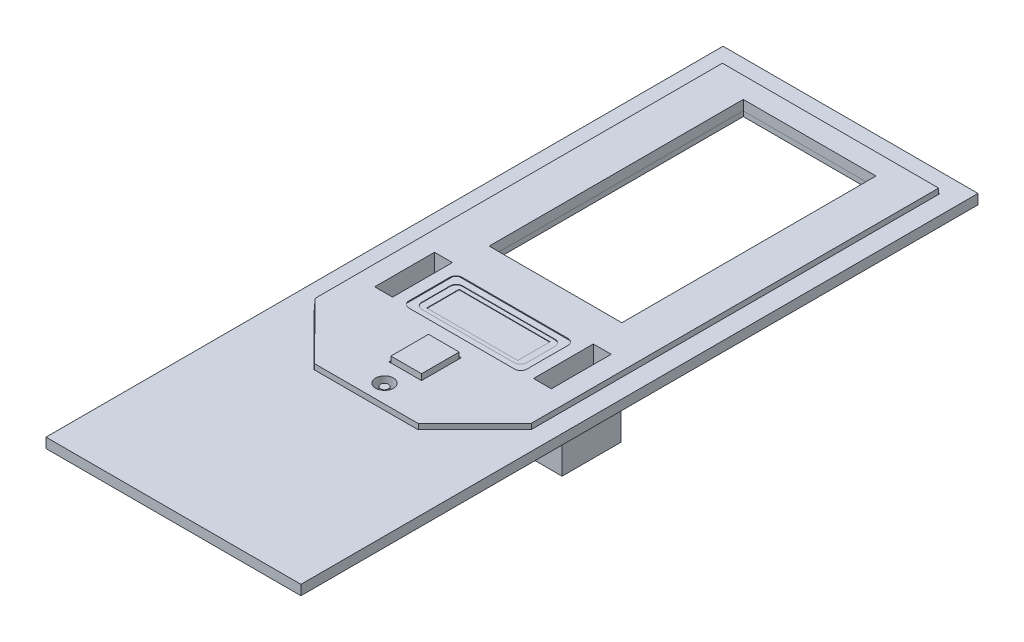
from build123d import *

# Parameters (mm, degrees)
SKETCH1_W                   = 51.332398317
SKETCH1_H                   = 136.325385694
BOSS_EXTRUDE1_DEPTH         = 2
CUT_EXTRUDE1_DEPTH          = 1
SKETCH3_W                   = 26.718092566
SKETCH3_H                   = 51.160838605
CUT_EXTRUDE2_DEPTH          = 1
SKETCH4_W                   = 20.659186536
SKETCH4_H                   = 13.604488078
BOSS_EXTRUDE2_DEPTH         = 1
SKETCH5_W                   = 6.521739131
SKETCH5_H                   = 14.853538096
SKETCH5_W_2                 = 6.52173913
SKETCH5_H_2                 = 15.644764374
CUT_EXTRUDE3_DEPTH          = 1
SKETCH6_W                   = 6.171107994
SKETCH6_H                   = 7.573632539
CUT_EXTRUDE4_DEPTH          = 1
SKETCH7_R                   = 2.489481066
CUT_EXTRUDE5_DEPTH          = 1
BOSS_EXTRUDE3_DEPTH         = 1
SKETCH10_W                  = 6.171107994
SKETCH10_H                  = 7.573632539
BOSS_EXTRUDE4_DEPTH         = 4
BOSS_EXTRUDE5_DEPTH         = 2
SKETCH12_W                  = 6.571107994
SKETCH12_H                  = 7.973632539
CUT_EXTRUDE6_DEPTH          = 2
SKETCH13_R                  = 1.8
SKETCH13_W                  = 26.718092566
SKETCH13_H                  = 51.160838605
CUT_EXTRUDE9_DEPTH          = 2
SKETCH14_R                  = 2.2
SKETCH14_R_2                = 1.8
BOSS_EXTRUDE11_DEPTH        = 2
SKETCH17_R                  = 2.2
BOSS_EXTRUDE12_DEPTH        = 1
SKETCH18_R                  = 0.8
BOSS_EXTRUDE15_DEPTH        = 3.4
EXTRUDE_THIN3_OUTLINE_W     = 5.6
EXTRUDE_THIN3_OUTLINE_H     = 14.844764374
EXTRUDE_THIN3_OUTLINE_W_2   = 3.6
EXTRUDE_THIN3_OUTLINE_H_2   = 12.844764374
EXTRUDE_THIN3_DEPTH         = 13.32398317
EXTRUDE_THIN3_2_OUTLINE_W   = 5.6
EXTRUDE_THIN3_2_OUTLINE_H   = 14.053538096
EXTRUDE_THIN3_2_OUTLINE_W_2 = 3.6
EXTRUDE_THIN3_2_OUTLINE_H_2 = 12.053538096
EXTRUDE_THIN3_2_DEPTH       = 13.32398317
SKETCH26_W                  = 3.6
SKETCH26_H                  = 12.053538096
SKETCH26_H_2                = 12.844764374
CUT_EXTRUDE12_DEPTH         = 13.32398317
SKETCH27_W                  = 5.6
SKETCH27_H                  = 14.053538096
BOSS_EXTRUDE18_DEPTH        = 1
SKETCH27_W_2                = 5.570395019
SKETCH27_H_2                = 14.844764374
BOSS_EXTRUDE18_2_DEPTH      = 1
SKETCH28_W                  = 20.659186536
SKETCH28_H                  = 13.604488078
CUT_EXTRUDE13_DEPTH         = 1
SKETCH29_W                  = 23.777559608
SKETCH29_H                  = 10.728152402
CUT_EXTRUDE15_DEPTH         = 10
SKETCH30_W                  = 23.777559608
SKETCH30_H                  = 10.728152402
SKETCH30_W_2                = 21.112762974
SKETCH30_H_2                = 8.203608222
BOSS_EXTRUDE20_DEPTH        = 1.8
SKETCH31_W                  = 21.112762974
SKETCH31_H                  = 8.203608222
BOSS_EXTRUDE21_DEPTH        = 1.6
SKETCH35_W                  = 23.977559608
SKETCH35_H                  = 10.928152402
CUT_EXTRUDE21_DEPTH         = 1.9
FILLET2_R                   = 1.25
FILLET3_R                   = 1.25
SKETCH37_W                  = 18.307713885
SKETCH37_H                  = 6.527591392
CUT_EXTRUDE22_DEPTH         = 0.1
SKETCH41_W                  = 18.307713885
SKETCH41_H                  = 6.527591392
BOSS_EXTRUDE27_DEPTH        = 0.1
SKETCH43_W                  = 18.307713885
SKETCH43_H                  = 6.527591392
BOSS_EXTRUDE28_DEPTH        = 0.1
CUT_EXTRUDE24_DEPTH         = 40.1
SKETCH51_W                  = 5.6
SKETCH51_H                  = 4.468914857
BOSS_EXTRUDE29_DEPTH        = 1
BOSS_EXTRUDE29_2_DEPTH      = 1
SKETCH52_W                  = 5.6
SKETCH52_H                  = 1
BOSS_EXTRUDE30_DEPTH        = 2.5
BOSS_EXTRUDE30_2_DEPTH      = 2.5
SKETCH53_W                  = 5.6
SKETCH53_H                  = 1
BOSS_EXTRUDE31_DEPTH        = 1
BOSS_EXTRUDE32_REACH        = 81.818
SKETCH54_W                  = 5.6
SKETCH54_H                  = 1
SKETCH55_W                  = 3.6
SKETCH55_H                  = 0.791226278
BOSS_EXTRUDE33_DEPTH        = 14.323983
SKETCH56_W                  = 0.791226278
SKETCH56_H                  = 13.32398317
CUT_EXTRUDE25_DEPTH         = 5.6
CUT_EXTRUDE_THIN1_DEPTH     = 1


with BuildPart() as part:
    # Sketch1 → Boss-Extrude1 (new body)
    with BuildSketch(Plane(origin=(0, 0, 0), x_dir=(1, 0, 0), z_dir=(0, 1, 0))):
        with Locations((-5.767223106, -3.58751015)):
            Rectangle(SKETCH1_W, SKETCH1_H)
    extrude(amount=BOSS_EXTRUDE1_DEPTH)

    # Sketch2 → Cut-Extrude1 (cut)
    with BuildSketch(Plane(origin=(0, 2, 0), x_dir=(1, 0, 0), z_dir=(0, 1, 0))):
        Polygon((-27.541416655, -30.445855171), (-27.541416655, 60.542924633), (16.006970442, 60.542924633), (16.006970442, -30.445855171), (4.678976052, -41.666051524), (-16.213422265, -41.666051524), align=None)
    extrude(amount=-CUT_EXTRUDE1_DEPTH, mode=Mode.SUBTRACT)

    # Sketch3 → Cut-Extrude2 (cut)
    with BuildSketch(Plane(origin=(0, 1, 0), x_dir=(1, 0, 0), z_dir=(0, 1, 0))):
        with Locations((-5.767223107, 30.754931698)):
            Rectangle(SKETCH3_W, SKETCH3_H)
    extrude(amount=-CUT_EXTRUDE2_DEPTH, mode=Mode.SUBTRACT)

    # Sketch4 → Boss-Extrude2 (add)
    with BuildSketch(Plane(origin=(0, 1, 0), x_dir=(1, 0, 0), z_dir=(0, 1, 0))):
        with Locations((-5.767223107, -7.988180452)):
            Rectangle(SKETCH4_W, SKETCH4_H)
    extrude(amount=BOSS_EXTRUDE2_DEPTH)

    # Sketch5 → Cut-Extrude3 (cut)
    with BuildSketch(Plane(origin=(0, 1, 0), x_dir=(1, 0, 0), z_dir=(0, 1, 0))):
        with Locations((-21.756002911, -7.426769048)):
            Rectangle(SKETCH5_W, SKETCH5_H)
        with Locations((10.221556697, -7.031155909)):
            Rectangle(SKETCH5_W_2, SKETCH5_H_2)
    extrude(amount=-CUT_EXTRUDE3_DEPTH, mode=Mode.SUBTRACT)

    # Sketch6 → Cut-Extrude4 (cut)
    with BuildSketch(Plane(origin=(0, 1, 0), x_dir=(1, 0, 0), z_dir=(0, 1, 0))):
        with Locations((-5.767223107, -21.101784941)):
            Rectangle(SKETCH6_W, SKETCH6_H)
    extrude(amount=-CUT_EXTRUDE4_DEPTH, mode=Mode.SUBTRACT)

    # Sketch7 → Cut-Extrude5 (cut)
    with BuildSketch(Plane(origin=(0, 1, 0), x_dir=(1, 0, 0), z_dir=(0, 1, 0))):
        with Locations(Location((-5.767223107, -29.250452542, 0), (0, 0, 270))):
            Circle(SKETCH7_R)
    extrude(amount=-CUT_EXTRUDE5_DEPTH, mode=Mode.SUBTRACT)

    # Sketch8 → Boss-Extrude3 (add)
    with BuildSketch(Plane(origin=(0, 1, 0), x_dir=(1, 0, 0), z_dir=(0, 1, 0))):
        Polygon((-27.541416655, -21.480466567), (-27.541416655, -30.445855171), (-16.213422265, -41.666051524), (4.678976052, -41.666051524), (16.006970442, -30.445855171), (16.006970442, -21.480466567), (4.673870862, -32.903327717), (-16.208317076, -32.903327717), align=None)
    extrude(amount=BOSS_EXTRUDE3_DEPTH)

    # Sketch10 → Boss-Extrude4 (add)
    with BuildSketch(Plane.XZ):
        with Locations((-5.767223107, 21.101784941)):
            Rectangle(SKETCH10_W, SKETCH10_H)
    extrude(amount=-BOSS_EXTRUDE4_DEPTH)

    # Sketch28 → Cut-Extrude13 (cut)
    with BuildSketch(Plane(origin=(0, 2, 0), x_dir=(1, 0, 0), z_dir=(0, 1, 0))):
        with Locations((-5.767223107, -7.988180452)):
            Rectangle(SKETCH28_W, SKETCH28_H)
    extrude(amount=-CUT_EXTRUDE13_DEPTH, mode=Mode.SUBTRACT)


with BuildPart() as body_2:
    # Sketch11 → Boss-Extrude5 (new body)
    with BuildSketch(Plane(origin=(0, 1, 0), x_dir=(1, 0, 0), z_dir=(0, 1, 0))):
        Polygon((-27.541416655, 60.542924633), (16.006970442, 60.542924633), (16.006970442, -21.480466567), (4.673870862, -32.903327717), (-16.208317076, -32.903327717), (-27.541416655, -21.480466567), align=None)
    extrude(amount=BOSS_EXTRUDE5_DEPTH)

    # Sketch12 → Cut-Extrude6 (cut)
    with BuildSketch(Plane(origin=(0, 3, 0), x_dir=(1, 0, 0), z_dir=(0, 1, 0))):
        with Locations((-5.767223107, -21.10178494)):
            Rectangle(SKETCH12_W, SKETCH12_H)
    extrude(amount=-CUT_EXTRUDE6_DEPTH, mode=Mode.SUBTRACT)

    # Sketch13 → Cut-Extrude9 (cut)
    with BuildSketch(Plane.XZ.offset(-1)):
        with Locations(Location((-5.767223107, 29.250452542, 0), (0, 0, 270))):
            Circle(SKETCH13_R)
        with Locations((-5.767223107, -30.754931698)):
            Rectangle(SKETCH13_W, SKETCH13_H)
    extrude(amount=-CUT_EXTRUDE9_DEPTH, mode=Mode.SUBTRACT)


with BuildPart() as body_3:
    # Sketch14 → Boss-Extrude11 (new body)
    with BuildSketch(Plane.XZ.offset(-1)):
        with Locations(Location((-5.767223107, 29.250452542, 0), (0, 0, 270))):
            Circle(SKETCH14_R)
        with Locations(Location((-5.767223107, 29.250452542, 0), (0, 0, 270))):
            Circle(SKETCH14_R_2, mode=Mode.SUBTRACT)
    extrude(amount=BOSS_EXTRUDE11_DEPTH)

    # Combine1: union body 2
    add(body_2.part)

    # Sketch17 → Boss-Extrude12 (add)
    with BuildSketch(Plane.XZ.offset(1)):
        with Locations(Location((-5.767223107, 29.250452542, 0), (0, 0, 270))):
            Circle(SKETCH17_R)
    extrude(amount=BOSS_EXTRUDE12_DEPTH)


with BuildPart() as body_3_2:
    # Sketch18 → Boss-Extrude15 (new body)
    with BuildSketch(Plane(origin=(0, -1, 0), x_dir=(1, 0, 0), z_dir=(0, 1, 0))):
        with Locations(Location((-5.767223107, -29.250452542, 0), (0, 0, 270))):
            Circle(SKETCH18_R)
    extrude(amount=BOSS_EXTRUDE15_DEPTH)


with BuildPart() as body_3_1:
    add(body_3.part)

    # Combine3: union body 3 2
    add(body_3_2.part)

    # Sketch26 → Cut-Extrude12 (cut)
    with BuildSketch(Plane.XZ.offset(-1)):
        with Locations((-21.756002911, 7.426769048)):
            Rectangle(SKETCH26_W, SKETCH26_H)
        with Locations((10.221556697, 7.031155909)):
            Rectangle(SKETCH26_W, SKETCH26_H_2)
    extrude(amount=-CUT_EXTRUDE12_DEPTH, mode=Mode.SUBTRACT)


with BuildPart() as body_3_3:
    # Extrude-Thin3: read off the stored shape, not the designer's step
    # Extrude-Thin3 outline → Extrude-Thin3 (new body)
    with BuildSketch(Plane.XZ.offset(-1)):
        with Locations((10.221556697, 7.031155909)):
            Rectangle(EXTRUDE_THIN3_OUTLINE_W, EXTRUDE_THIN3_OUTLINE_H)
        with Locations((10.221556697, 7.031155909)):
            Rectangle(EXTRUDE_THIN3_OUTLINE_W_2, EXTRUDE_THIN3_OUTLINE_H_2, mode=Mode.SUBTRACT)
    extrude(amount=EXTRUDE_THIN3_DEPTH)


with BuildPart() as body_4:
    # Extrude-Thin3 2 outline → Extrude-Thin3 2 (new body)
    with BuildSketch(Plane.XZ.offset(-1)):
        with Locations((-21.756002911, 7.426769048)):
            Rectangle(EXTRUDE_THIN3_2_OUTLINE_W, EXTRUDE_THIN3_2_OUTLINE_H)
        with Locations((-21.756002911, 7.426769048)):
            Rectangle(EXTRUDE_THIN3_2_OUTLINE_W_2, EXTRUDE_THIN3_2_OUTLINE_H_2, mode=Mode.SUBTRACT)
    extrude(amount=EXTRUDE_THIN3_2_DEPTH)


with BuildPart() as body_5:
    # Sketch27 → Boss-Extrude18 (new body)
    with BuildSketch(Plane.XZ.offset(12.32398317)):
        with Locations((-21.756002911, 7.426769048)):
            Rectangle(SKETCH27_W, SKETCH27_H)
    extrude(amount=-BOSS_EXTRUDE18_DEPTH)


with BuildPart() as body_6:
    # Sketch27 → Boss-Extrude18 2 (new body)
    with BuildSketch(Plane.XZ.offset(12.32398317)):
        with Locations((10.206754207, 7.031155909)):
            Rectangle(SKETCH27_W_2, SKETCH27_H_2)
    extrude(amount=-BOSS_EXTRUDE18_2_DEPTH)


with BuildPart() as body_4_1:
    add(body_4.part)

    # Combine4: union body 3 3, body 3, body 5, body 6
    add(body_3_3.part)
    add(body_3_1.part)
    add(body_5.part)
    add(body_6.part)

    # Sketch29 → Cut-Extrude15 (cut)
    with BuildSketch(Plane(origin=(0, 3, 0), x_dir=(1, 0, 0), z_dir=(0, 1, 0))):
        with Locations((-5.767223107, -8.341916313)):
            Rectangle(SKETCH29_W, SKETCH29_H)
    extrude(amount=-CUT_EXTRUDE15_DEPTH, mode=Mode.SUBTRACT)

    # Sketch35 → Cut-Extrude21 (cut)
    with BuildSketch(Plane.XZ.offset(-1)):
        with Locations((-5.767223107, 8.341916313)):
            Rectangle(SKETCH35_W, SKETCH35_H)
    extrude(amount=-CUT_EXTRUDE21_DEPTH, mode=Mode.SUBTRACT)

    # Fillet2
    fillet2_edges = [body_4_1.edges().sort_by_distance(p)[0] for p in [
        (-17.656002911, 2.95, 13.705992514),
        (6.121556697, 2.95, 13.705992514),
        (6.121556697, 2.95, 2.977840112),
        (-17.656002911, 2.95, 2.977840112),
    ]]
    fillet(fillet2_edges, radius=FILLET2_R)

    # Sketch50 → Cut-Extrude24 (cut)
    with BuildSketch(Plane(origin=(13.021556697, 0, 0), x_dir=(0, 0, -1), z_dir=(1, 0, 0))):
        Polygon((-14.453538096, 1), (-11.293538096, -2.16), (-11.293538096, -12.32398317), (-14.453538096, -12.32398317), align=None)
    extrude(amount=-CUT_EXTRUDE24_DEPTH, mode=Mode.SUBTRACT)


with BuildPart() as body_3_4:
    # Sketch30 → Boss-Extrude20 (new body)
    with BuildSketch(Plane(origin=(0, 1, 0), x_dir=(1, 0, 0), z_dir=(0, 1, 0))):
        with Locations((-5.767223107, -8.341916313)):
            Rectangle(SKETCH30_W, SKETCH30_H)
        with Locations((-5.767223107, -8.341916313)):
            Rectangle(SKETCH30_W_2, SKETCH30_H_2, mode=Mode.SUBTRACT)
    extrude(amount=BOSS_EXTRUDE20_DEPTH)


with BuildPart() as body_4_2:
    # Sketch31 → Boss-Extrude21 (new body)
    with BuildSketch(Plane(origin=(0, 1, 0), x_dir=(1, 0, 0), z_dir=(0, 1, 0))):
        with Locations((-5.767223107, -8.341916313)):
            Rectangle(SKETCH31_W, SKETCH31_H)
    extrude(amount=BOSS_EXTRUDE21_DEPTH)


with BuildPart() as part_1:
    add(part.part)

    # Combine5: union body 3 4, body 4 2
    add(body_3_4.part)
    add(body_4_2.part)

    # Fillet3
    fillet3_edges = [part_1.edges().sort_by_distance(p)[0] for p in [
        (-16.323604594, 2.7, 12.443720424),
        (4.78915838, 2.7, 12.443720424),
        (4.78915838, 2.7, 4.240112202),
        (-16.323604594, 2.7, 4.240112202),
    ]]
    fillet(fillet3_edges, radius=FILLET3_R)

    # Sketch37 → Cut-Extrude22 (cut)
    with BuildSketch(Plane(origin=(0, 2.6, 0), x_dir=(1, 0, 0), z_dir=(0, 1, 0))):
        with Locations((-5.767223107, -8.341916313)):
            Rectangle(SKETCH37_W, SKETCH37_H)
    extrude(amount=-CUT_EXTRUDE22_DEPTH, mode=Mode.SUBTRACT)


with BuildPart() as body_3_5:
    # Sketch41 → Boss-Extrude27 (new body)
    with BuildSketch(Plane(origin=(0, 2.6, 0), x_dir=(1, 0, 0), z_dir=(0, 1, 0))):
        with BuildLine():
            Line((-15.073604594, -12.443720424), (3.53915838, -12.443720424))
            ThreePointArc((3.53915838, -12.443720424), (4.423041856, -12.077603901), (4.78915838, -11.193720424))
            Line((4.78915838, -11.193720424), (4.78915838, -5.490112202))
            ThreePointArc((4.78915838, -5.490112202), (4.423041856, -4.606228725), (3.53915838, -4.240112202))
            Line((3.53915838, -4.240112202), (-15.073604594, -4.240112202))
            ThreePointArc((-15.073604594, -4.240112202), (-15.95748807, -4.606228725), (-16.323604594, -5.490112202))
            Line((-16.323604594, -5.490112202), (-16.323604594, -11.193720424))
            ThreePointArc((-16.323604594, -11.193720424), (-15.95748807, -12.077603901), (-15.073604594, -12.443720424))
        make_face()
        with Locations((-5.767223107, -8.341916313)):
            Rectangle(SKETCH41_W, SKETCH41_H, mode=Mode.SUBTRACT)
    extrude(amount=BOSS_EXTRUDE27_DEPTH)

    # Combine6: union part
    add(part_1.part)


with BuildPart() as body_3_6:
    # Sketch43 → Boss-Extrude28 (new body)
    with BuildSketch(Plane(origin=(0, 2.5, 0), x_dir=(1, 0, 0), z_dir=(0, 1, 0))):
        with Locations((-5.767223107, -8.341916313)):
            Rectangle(SKETCH43_W, SKETCH43_H)
    extrude(amount=BOSS_EXTRUDE28_DEPTH)

    # Combine7: union body 3 5
    add(body_3_5.part)

    # Sketch58 → Cut-Extrude-Thin1 (cut)
    with BuildSketch(Plane(origin=(0, 1, 0), x_dir=(1, 0, 0), z_dir=(0, 1, 0))):
        Polygon((-16.249969686, -33.003327717), (4.715523472, -33.003327717), (16.106970442, -21.521657048), (16.106970442, 60.642924633), (-27.641416655, 60.642924633), (-27.641416655, -21.521657048), align=None)
        Polygon((-16.208317076, -32.903327717), (4.673870862, -32.903327717), (16.006970442, -21.480466567), (16.006970442, 60.542924633), (-27.541416655, 60.542924633), (-27.541416655, -21.480466567), align=None, mode=Mode.SUBTRACT)
    extrude(amount=CUT_EXTRUDE_THIN1_DEPTH, mode=Mode.SUBTRACT)


with BuildPart() as body_3_7:
    # Sketch51 → Boss-Extrude29 (new body)
    with BuildSketch(Plane(origin=(0, -6.726769048, 6.726769048), x_dir=(1, 0, 0), z_dir=(0, -0.7071067811865475, 0.7071067811865476))):
        with Locations((10.221556697, 8.692844153)):
            Rectangle(SKETCH51_W, SKETCH51_H)
    extrude(amount=BOSS_EXTRUDE29_DEPTH)


with BuildPart() as body_4_3:
    # Sketch51 → Boss-Extrude29 2 (new body)
    with BuildSketch(Plane(origin=(0, -6.726769048, 6.726769048), x_dir=(1, 0, 0), z_dir=(0, -0.7071067811865475, 0.7071067811865476))):
        with Locations((-21.756002911, 8.692844153)):
            Rectangle(SKETCH51_W, SKETCH51_H)
    extrude(amount=BOSS_EXTRUDE29_2_DEPTH)


with BuildPart() as body_5_2:
    # Sketch52 → Boss-Extrude30 (new body)
    with BuildSketch(Plane(origin=(0, 7.726769048, 7.726769048), x_dir=(1, 0, 0), z_dir=(0, 0.7071067811865476, 0.7071067811865475))):
        with Locations((10.221556697, -10.013088019)):
            Rectangle(SKETCH52_W, SKETCH52_H)
    extrude(amount=BOSS_EXTRUDE30_DEPTH)


with BuildPart() as body_6_2:
    # Sketch52 → Boss-Extrude30 2 (new body)
    with BuildSketch(Plane(origin=(0, 7.726769048, 7.726769048), x_dir=(1, 0, 0), z_dir=(0, 0.7071067811865476, 0.7071067811865475))):
        with Locations((-21.756002911, -10.013088019)):
            Rectangle(SKETCH52_W, SKETCH52_H)
    extrude(amount=BOSS_EXTRUDE30_2_DEPTH)


with BuildPart() as body_4_4:
    add(body_4_1.part)

    # Combine8: union body 3 7, body 4 3, body 5 2, body 6 2
    add(body_3_7.part)
    add(body_4_3.part)
    add(body_5_2.part)
    add(body_6_2.part)

    # Sketch53 → Boss-Extrude31 (add)
    with BuildSketch(Plane.XY.offset(11.293538096)):
        with Locations((-21.756002911, -11.82398317)):
            Rectangle(SKETCH53_W, SKETCH53_H)
        with Locations((10.221556697, -11.82398317)):
            Rectangle(SKETCH53_W, SKETCH53_H)
    extrude(amount=BOSS_EXTRUDE31_DEPTH)


with BuildPart() as body_3_8:

    # Sketch54 → Boss-Extrude32 (new, up to next)
    with BuildSketch(Plane(origin=(0, -11.32398317, 0), x_dir=(1, 0, 0), z_dir=(0, 1, 0)), mode=Mode.PRIVATE) as boss_extrude32_sk1:
        with Locations((-21.756002911, -11.793538096)):
            Rectangle(SKETCH54_W, SKETCH54_H)
    boss_extrude32_tool1 = extrude(boss_extrude32_sk1.sketch, amount=BOSS_EXTRUDE32_REACH, mode=Mode.PRIVATE) - body_4_4.part
    # Sketch54 → Boss-Extrude32 (new, up to next)
    with BuildSketch(Plane(origin=(0, -11.32398317, 0), x_dir=(1, 0, 0), z_dir=(0, 1, 0)), mode=Mode.PRIVATE) as boss_extrude32_sk2:
        with Locations((10.221556697, -11.793538096)):
            Rectangle(SKETCH54_W, SKETCH54_H)
    boss_extrude32_tool2 = extrude(boss_extrude32_sk2.sketch, amount=BOSS_EXTRUDE32_REACH, mode=Mode.PRIVATE) - body_4_4.part
    add(boss_extrude32_tool1.solids().sort_by_distance((-21.756003, -11.323983, 11.793538))[0])
    add(boss_extrude32_tool2.solids().sort_by_distance((10.221557, -11.323983, 11.793538))[0])


with BuildPart() as body_4_5:
    add(body_4_4.part)

    # Combine9: union body 3 8
    add(body_3_8.part)

    # Sketch55 → Boss-Extrude33 (add)
    with BuildSketch(Plane(origin=(0, -11.32398317, 0), x_dir=(1, 0, 0), z_dir=(0, 1, 0))):
        with Locations((10.221556697, -1.004386861)):
            Rectangle(SKETCH55_W, SKETCH55_H)
    extrude(amount=BOSS_EXTRUDE33_DEPTH)

    # Sketch56 → Cut-Extrude25 (cut)
    with BuildSketch(Plane.ZY.offset(-7.421556697)):
        with Locations((0.004386861, -5.661991585)):
            Rectangle(SKETCH56_W, SKETCH56_H)
    extrude(amount=-CUT_EXTRUDE25_DEPTH, mode=Mode.SUBTRACT)


solid = Compound([body_3_6.part, body_4_5.part])
